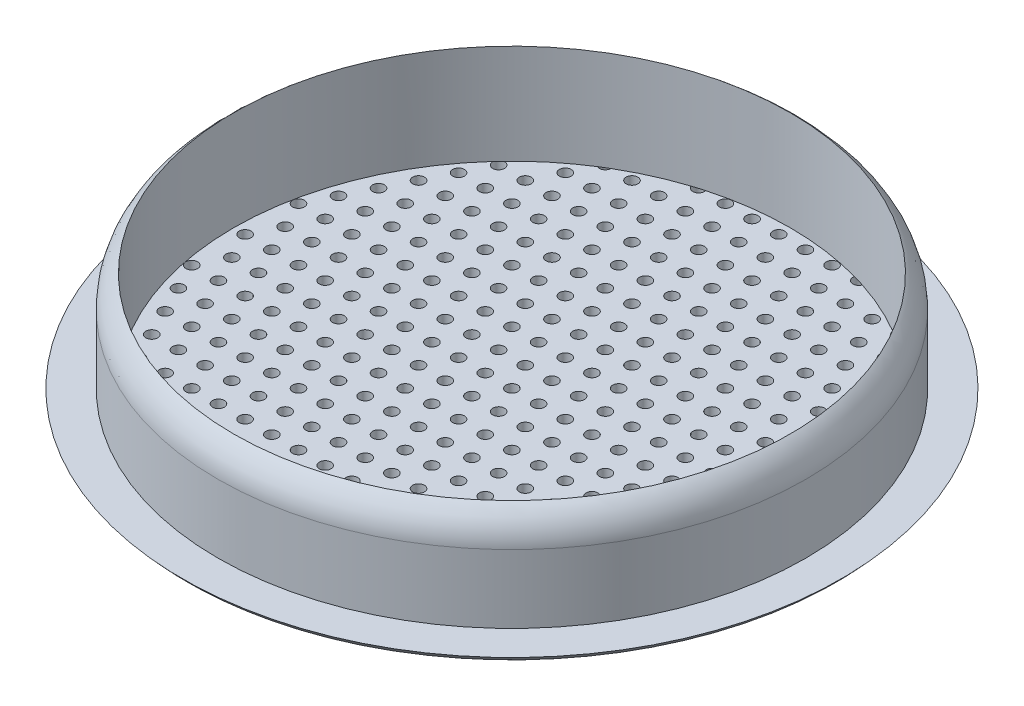
from build123d import *

# Parameters (mm, degrees)
SKETCH3_R          = 0.75
CUT_EXTRUDE1_DEPTH = 2
FILLET1_R          = 5


with BuildPart() as part:
    # Sketch2 → Revolve1 (revolve)
    with BuildSketch(Plane.XY, mode=Mode.PRIVATE) as revolve1_sk:
        Polygon((-35.465, 0), (-35.465, 12.7), (-37.465, 12.7), (-37.465, 0), (-42, 0), (-42, -2), (0, -2), (0, 0), align=None)
    revolve(revolve1_sk.sketch.rotate(Axis((0, 0, 0), (0, 1, 0)), 270), axis=Axis((0, 0, 0), (0, 1, 0)))

    # Sketch3 → Cut-Extrude1 (cut)
    with BuildSketch(Plane(origin=(0, 0, 0), x_dir=(1, 0, 0), z_dir=(0, 1, 0))):
        with Locations(Location((0, 0, 0), (0, 0, 270))):
            Circle(SKETCH3_R)
        with Locations(Location((3.4, 0, 0), (0, 0, 270))):
            Circle(SKETCH3_R)
        with Locations(Location((6.8, 0, 0), (0, 0, 270))):
            Circle(SKETCH3_R)
        with Locations(Location((10.2, 0, 0), (0, 0, 270))):
            Circle(SKETCH3_R)
        with Locations(Location((13.6, 0, 0), (0, 0, 270))):
            Circle(SKETCH3_R)
        with Locations(Location((17, 0, 0), (0, 0, 270))):
            Circle(SKETCH3_R)
        with Locations(Location((20.4, 0, 0), (0, 0, 270))):
            Circle(SKETCH3_R)
        with Locations(Location((23.8, 0, 0), (0, 0, 270))):
            Circle(SKETCH3_R)
        with Locations(Location((27.2, 0, 0), (0, 0, 270))):
            Circle(SKETCH3_R)
        with Locations(Location((30.6, 0, 0), (0, 0, 270))):
            Circle(SKETCH3_R)
        with Locations(Location((34, 0, 0), (0, 0, 270))):
            Circle(SKETCH3_R)
        with Locations(Location((3.4, 6.8, 0), (0, 0, 270))):
            Circle(SKETCH3_R)
        with Locations(Location((6.8, 6.8, 0), (0, 0, 270))):
            Circle(SKETCH3_R)
        with Locations(Location((10.2, 6.8, 0), (0, 0, 270))):
            Circle(SKETCH3_R)
        with Locations(Location((13.6, 6.8, 0), (0, 0, 270))):
            Circle(SKETCH3_R)
        with Locations(Location((17, 6.8, 0), (0, 0, 270))):
            Circle(SKETCH3_R)
        with Locations(Location((20.4, 6.8, 0), (0, 0, 270))):
            Circle(SKETCH3_R)
        with Locations(Location((23.8, 6.8, 0), (0, 0, 270))):
            Circle(SKETCH3_R)
        with Locations(Location((27.2, 6.8, 0), (0, 0, 270))):
            Circle(SKETCH3_R)
        with Locations(Location((30.6, 6.8, 0), (0, 0, 270))):
            Circle(SKETCH3_R)
        with Locations(Location((34, 6.8, 0), (0, 0, 270))):
            Circle(SKETCH3_R)
        with Locations(Location((3.4, 13.6, 0), (0, 0, 270))):
            Circle(SKETCH3_R)
        with Locations(Location((6.8, 13.6, 0), (0, 0, 270))):
            Circle(SKETCH3_R)
        with Locations(Location((10.2, 13.6, 0), (0, 0, 270))):
            Circle(SKETCH3_R)
        with Locations(Location((13.6, 13.6, 0), (0, 0, 270))):
            Circle(SKETCH3_R)
        with Locations(Location((17, 13.6, 0), (0, 0, 270))):
            Circle(SKETCH3_R)
        with Locations(Location((20.4, 13.6, 0), (0, 0, 270))):
            Circle(SKETCH3_R)
        with Locations(Location((23.8, 13.6, 0), (0, 0, 270))):
            Circle(SKETCH3_R)
        with Locations(Location((27.2, 13.6, 0), (0, 0, 270))):
            Circle(SKETCH3_R)
        with Locations(Location((30.6, 13.6, 0), (0, 0, 270))):
            Circle(SKETCH3_R)
        with Locations(Location((3.4, 20.4, 0), (0, 0, 270))):
            Circle(SKETCH3_R)
        with Locations(Location((6.8, 20.4, 0), (0, 0, 270))):
            Circle(SKETCH3_R)
        with Locations(Location((10.2, 20.4, 0), (0, 0, 270))):
            Circle(SKETCH3_R)
        with Locations(Location((13.6, 20.4, 0), (0, 0, 270))):
            Circle(SKETCH3_R)
        with Locations(Location((17, 20.4, 0), (0, 0, 270))):
            Circle(SKETCH3_R)
        with Locations(Location((20.4, 20.4, 0), (0, 0, 270))):
            Circle(SKETCH3_R)
        with Locations(Location((23.8, 20.4, 0), (0, 0, 270))):
            Circle(SKETCH3_R)
        with Locations(Location((27.2, 20.4, 0), (0, 0, 270))):
            Circle(SKETCH3_R)
        with Locations(Location((3.4, 27.2, 0), (0, 0, 270))):
            Circle(SKETCH3_R)
        with Locations(Location((6.8, 27.2, 0), (0, 0, 270))):
            Circle(SKETCH3_R)
        with Locations(Location((10.2, 27.2, 0), (0, 0, 270))):
            Circle(SKETCH3_R)
        with Locations(Location((13.6, 27.2, 0), (0, 0, 270))):
            Circle(SKETCH3_R)
        with Locations(Location((17, 27.2, 0), (0, 0, 270))):
            Circle(SKETCH3_R)
        with Locations(Location((20.4, 27.2, 0), (0, 0, 270))):
            Circle(SKETCH3_R)
        with Locations(Location((3.4, 34, 0), (0, 0, 270))):
            Circle(SKETCH3_R)
        with Locations(Location((6.8, 34, 0), (0, 0, 270))):
            Circle(SKETCH3_R)
        with Locations(Location((10.2, 34, 0), (0, 0, 270))):
            Circle(SKETCH3_R)
        with Locations(Location((13.6, 34, 0), (0, 0, 270))):
            Circle(SKETCH3_R)
        with Locations(Location((0, 6.8, 0), (0, 0, 270))):
            Circle(SKETCH3_R)
        with Locations(Location((0, 13.6, 0), (0, 0, 270))):
            Circle(SKETCH3_R)
        with Locations(Location((0, 20.4, 0), (0, 0, 270))):
            Circle(SKETCH3_R)
        with Locations(Location((0, 27.2, 0), (0, 0, 270))):
            Circle(SKETCH3_R)
        with Locations(Location((0, 34, 0), (0, 0, 270))):
            Circle(SKETCH3_R)
        with Locations(Location((1.7, 3.4, 0), (0, 0, 270))):
            Circle(SKETCH3_R)
        with Locations(Location((5.1, 3.4, 0), (0, 0, 270))):
            Circle(SKETCH3_R)
        with Locations(Location((8.5, 3.4, 0), (0, 0, 270))):
            Circle(SKETCH3_R)
        with Locations(Location((11.9, 3.4, 0), (0, 0, 270))):
            Circle(SKETCH3_R)
        with Locations(Location((15.3, 3.4, 0), (0, 0, 270))):
            Circle(SKETCH3_R)
        with Locations(Location((18.7, 3.4, 0), (0, 0, 270))):
            Circle(SKETCH3_R)
        with Locations(Location((22.1, 3.4, 0), (0, 0, 270))):
            Circle(SKETCH3_R)
        with Locations(Location((25.5, 3.4, 0), (0, 0, 270))):
            Circle(SKETCH3_R)
        with Locations(Location((28.9, 3.4, 0), (0, 0, 270))):
            Circle(SKETCH3_R)
        with Locations(Location((32.3, 3.4, 0), (0, 0, 270))):
            Circle(SKETCH3_R)
        with Locations(Location((5.1, 10.2, 0), (0, 0, 270))):
            Circle(SKETCH3_R)
        with Locations(Location((8.5, 10.2, 0), (0, 0, 270))):
            Circle(SKETCH3_R)
        with Locations(Location((11.9, 10.2, 0), (0, 0, 270))):
            Circle(SKETCH3_R)
        with Locations(Location((15.3, 10.2, 0), (0, 0, 270))):
            Circle(SKETCH3_R)
        with Locations(Location((18.7, 10.2, 0), (0, 0, 270))):
            Circle(SKETCH3_R)
        with Locations(Location((22.1, 10.2, 0), (0, 0, 270))):
            Circle(SKETCH3_R)
        with Locations(Location((25.5, 10.2, 0), (0, 0, 270))):
            Circle(SKETCH3_R)
        with Locations(Location((28.9, 10.2, 0), (0, 0, 270))):
            Circle(SKETCH3_R)
        with Locations(Location((32.3, 10.2, 0), (0, 0, 270))):
            Circle(SKETCH3_R)
        with Locations(Location((5.1, 17, 0), (0, 0, 270))):
            Circle(SKETCH3_R)
        with Locations(Location((8.5, 17, 0), (0, 0, 270))):
            Circle(SKETCH3_R)
        with Locations(Location((11.9, 17, 0), (0, 0, 270))):
            Circle(SKETCH3_R)
        with Locations(Location((15.3, 17, 0), (0, 0, 270))):
            Circle(SKETCH3_R)
        with Locations(Location((18.7, 17, 0), (0, 0, 270))):
            Circle(SKETCH3_R)
        with Locations(Location((22.1, 17, 0), (0, 0, 270))):
            Circle(SKETCH3_R)
        with Locations(Location((25.5, 17, 0), (0, 0, 270))):
            Circle(SKETCH3_R)
        with Locations(Location((28.9, 17, 0), (0, 0, 270))):
            Circle(SKETCH3_R)
        with Locations(Location((5.1, 23.8, 0), (0, 0, 270))):
            Circle(SKETCH3_R)
        with Locations(Location((8.5, 23.8, 0), (0, 0, 270))):
            Circle(SKETCH3_R)
        with Locations(Location((11.9, 23.8, 0), (0, 0, 270))):
            Circle(SKETCH3_R)
        with Locations(Location((15.3, 23.8, 0), (0, 0, 270))):
            Circle(SKETCH3_R)
        with Locations(Location((18.7, 23.8, 0), (0, 0, 270))):
            Circle(SKETCH3_R)
        with Locations(Location((22.1, 23.8, 0), (0, 0, 270))):
            Circle(SKETCH3_R)
        with Locations(Location((25.5, 23.8, 0), (0, 0, 270))):
            Circle(SKETCH3_R)
        with Locations(Location((5.1, 30.6, 0), (0, 0, 270))):
            Circle(SKETCH3_R)
        with Locations(Location((8.5, 30.6, 0), (0, 0, 270))):
            Circle(SKETCH3_R)
        with Locations(Location((11.9, 30.6, 0), (0, 0, 270))):
            Circle(SKETCH3_R)
        with Locations(Location((15.3, 30.6, 0), (0, 0, 270))):
            Circle(SKETCH3_R)
        with Locations(Location((18.7, 30.6, 0), (0, 0, 270))):
            Circle(SKETCH3_R)
        with Locations(Location((1.7, 10.2, 0), (0, 0, 270))):
            Circle(SKETCH3_R)
        with Locations(Location((1.7, 17, 0), (0, 0, 270))):
            Circle(SKETCH3_R)
        with Locations(Location((1.7, 23.8, 0), (0, 0, 270))):
            Circle(SKETCH3_R)
        with Locations(Location((1.7, 30.6, 0), (0, 0, 270))):
            Circle(SKETCH3_R)
        with Locations(Location((-1.7, 30.6, 0), (0, 0, 270))):
            Circle(SKETCH3_R)
        with Locations(Location((-1.7, 23.8, 0), (0, 0, 270))):
            Circle(SKETCH3_R)
        with Locations(Location((-1.7, 17, 0), (0, 0, 270))):
            Circle(SKETCH3_R)
        with Locations(Location((-1.7, 10.2, 0), (0, 0, 270))):
            Circle(SKETCH3_R)
        with Locations(Location((-18.7, 30.6, 0), (0, 0, 270))):
            Circle(SKETCH3_R)
        with Locations(Location((-15.3, 30.6, 0), (0, 0, 270))):
            Circle(SKETCH3_R)
        with Locations(Location((-11.9, 30.6, 0), (0, 0, 270))):
            Circle(SKETCH3_R)
        with Locations(Location((-8.5, 30.6, 0), (0, 0, 270))):
            Circle(SKETCH3_R)
        with Locations(Location((-5.1, 30.6, 0), (0, 0, 270))):
            Circle(SKETCH3_R)
        with Locations(Location((-25.5, 23.8, 0), (0, 0, 270))):
            Circle(SKETCH3_R)
        with Locations(Location((-22.1, 23.8, 0), (0, 0, 270))):
            Circle(SKETCH3_R)
        with Locations(Location((-18.7, 23.8, 0), (0, 0, 270))):
            Circle(SKETCH3_R)
        with Locations(Location((-15.3, 23.8, 0), (0, 0, 270))):
            Circle(SKETCH3_R)
        with Locations(Location((-11.9, 23.8, 0), (0, 0, 270))):
            Circle(SKETCH3_R)
        with Locations(Location((-8.5, 23.8, 0), (0, 0, 270))):
            Circle(SKETCH3_R)
        with Locations(Location((-5.1, 23.8, 0), (0, 0, 270))):
            Circle(SKETCH3_R)
        with Locations(Location((-28.9, 17, 0), (0, 0, 270))):
            Circle(SKETCH3_R)
        with Locations(Location((-25.5, 17, 0), (0, 0, 270))):
            Circle(SKETCH3_R)
        with Locations(Location((-22.1, 17, 0), (0, 0, 270))):
            Circle(SKETCH3_R)
        with Locations(Location((-18.7, 17, 0), (0, 0, 270))):
            Circle(SKETCH3_R)
        with Locations(Location((-15.3, 17, 0), (0, 0, 270))):
            Circle(SKETCH3_R)
        with Locations(Location((-11.9, 17, 0), (0, 0, 270))):
            Circle(SKETCH3_R)
        with Locations(Location((-8.5, 17, 0), (0, 0, 270))):
            Circle(SKETCH3_R)
        with Locations(Location((-5.1, 17, 0), (0, 0, 270))):
            Circle(SKETCH3_R)
        with Locations(Location((-32.3, 10.2, 0), (0, 0, 270))):
            Circle(SKETCH3_R)
        with Locations(Location((-28.9, 10.2, 0), (0, 0, 270))):
            Circle(SKETCH3_R)
        with Locations(Location((-25.5, 10.2, 0), (0, 0, 270))):
            Circle(SKETCH3_R)
        with Locations(Location((-22.1, 10.2, 0), (0, 0, 270))):
            Circle(SKETCH3_R)
        with Locations(Location((-18.7, 10.2, 0), (0, 0, 270))):
            Circle(SKETCH3_R)
        with Locations(Location((-15.3, 10.2, 0), (0, 0, 270))):
            Circle(SKETCH3_R)
        with Locations(Location((-11.9, 10.2, 0), (0, 0, 270))):
            Circle(SKETCH3_R)
        with Locations(Location((-8.5, 10.2, 0), (0, 0, 270))):
            Circle(SKETCH3_R)
        with Locations(Location((-5.1, 10.2, 0), (0, 0, 270))):
            Circle(SKETCH3_R)
        with Locations(Location((-32.3, 3.4, 0), (0, 0, 270))):
            Circle(SKETCH3_R)
        with Locations(Location((-28.9, 3.4, 0), (0, 0, 270))):
            Circle(SKETCH3_R)
        with Locations(Location((-25.5, 3.4, 0), (0, 0, 270))):
            Circle(SKETCH3_R)
        with Locations(Location((-22.1, 3.4, 0), (0, 0, 270))):
            Circle(SKETCH3_R)
        with Locations(Location((-18.7, 3.4, 0), (0, 0, 270))):
            Circle(SKETCH3_R)
        with Locations(Location((-15.3, 3.4, 0), (0, 0, 270))):
            Circle(SKETCH3_R)
        with Locations(Location((-11.9, 3.4, 0), (0, 0, 270))):
            Circle(SKETCH3_R)
        with Locations(Location((-8.5, 3.4, 0), (0, 0, 270))):
            Circle(SKETCH3_R)
        with Locations(Location((-5.1, 3.4, 0), (0, 0, 270))):
            Circle(SKETCH3_R)
        with Locations(Location((-1.7, 3.4, 0), (0, 0, 270))):
            Circle(SKETCH3_R)
        with Locations(Location((-13.6, 34, 0), (0, 0, 270))):
            Circle(SKETCH3_R)
        with Locations(Location((-10.2, 34, 0), (0, 0, 270))):
            Circle(SKETCH3_R)
        with Locations(Location((-6.8, 34, 0), (0, 0, 270))):
            Circle(SKETCH3_R)
        with Locations(Location((-3.4, 34, 0), (0, 0, 270))):
            Circle(SKETCH3_R)
        with Locations(Location((-20.4, 27.2, 0), (0, 0, 270))):
            Circle(SKETCH3_R)
        with Locations(Location((-17, 27.2, 0), (0, 0, 270))):
            Circle(SKETCH3_R)
        with Locations(Location((-13.6, 27.2, 0), (0, 0, 270))):
            Circle(SKETCH3_R)
        with Locations(Location((-10.2, 27.2, 0), (0, 0, 270))):
            Circle(SKETCH3_R)
        with Locations(Location((-6.8, 27.2, 0), (0, 0, 270))):
            Circle(SKETCH3_R)
        with Locations(Location((-3.4, 27.2, 0), (0, 0, 270))):
            Circle(SKETCH3_R)
        with Locations(Location((-27.2, 20.4, 0), (0, 0, 270))):
            Circle(SKETCH3_R)
        with Locations(Location((-23.8, 20.4, 0), (0, 0, 270))):
            Circle(SKETCH3_R)
        with Locations(Location((-20.4, 20.4, 0), (0, 0, 270))):
            Circle(SKETCH3_R)
        with Locations(Location((-17, 20.4, 0), (0, 0, 270))):
            Circle(SKETCH3_R)
        with Locations(Location((-13.6, 20.4, 0), (0, 0, 270))):
            Circle(SKETCH3_R)
        with Locations(Location((-10.2, 20.4, 0), (0, 0, 270))):
            Circle(SKETCH3_R)
        with Locations(Location((-6.8, 20.4, 0), (0, 0, 270))):
            Circle(SKETCH3_R)
        with Locations(Location((-3.4, 20.4, 0), (0, 0, 270))):
            Circle(SKETCH3_R)
        with Locations(Location((-30.6, 13.6, 0), (0, 0, 270))):
            Circle(SKETCH3_R)
        with Locations(Location((-27.2, 13.6, 0), (0, 0, 270))):
            Circle(SKETCH3_R)
        with Locations(Location((-23.8, 13.6, 0), (0, 0, 270))):
            Circle(SKETCH3_R)
        with Locations(Location((-20.4, 13.6, 0), (0, 0, 270))):
            Circle(SKETCH3_R)
        with Locations(Location((-17, 13.6, 0), (0, 0, 270))):
            Circle(SKETCH3_R)
        with Locations(Location((-13.6, 13.6, 0), (0, 0, 270))):
            Circle(SKETCH3_R)
        with Locations(Location((-10.2, 13.6, 0), (0, 0, 270))):
            Circle(SKETCH3_R)
        with Locations(Location((-6.8, 13.6, 0), (0, 0, 270))):
            Circle(SKETCH3_R)
        with Locations(Location((-3.4, 13.6, 0), (0, 0, 270))):
            Circle(SKETCH3_R)
        with Locations(Location((-34, 6.8, 0), (0, 0, 270))):
            Circle(SKETCH3_R)
        with Locations(Location((-30.6, 6.8, 0), (0, 0, 270))):
            Circle(SKETCH3_R)
        with Locations(Location((-27.2, 6.8, 0), (0, 0, 270))):
            Circle(SKETCH3_R)
        with Locations(Location((-23.8, 6.8, 0), (0, 0, 270))):
            Circle(SKETCH3_R)
        with Locations(Location((-20.4, 6.8, 0), (0, 0, 270))):
            Circle(SKETCH3_R)
        with Locations(Location((-17, 6.8, 0), (0, 0, 270))):
            Circle(SKETCH3_R)
        with Locations(Location((-13.6, 6.8, 0), (0, 0, 270))):
            Circle(SKETCH3_R)
        with Locations(Location((-10.2, 6.8, 0), (0, 0, 270))):
            Circle(SKETCH3_R)
        with Locations(Location((-6.8, 6.8, 0), (0, 0, 270))):
            Circle(SKETCH3_R)
        with Locations(Location((-3.4, 6.8, 0), (0, 0, 270))):
            Circle(SKETCH3_R)
        with Locations(Location((-34, 0, 0), (0, 0, 270))):
            Circle(SKETCH3_R)
        with Locations(Location((-30.6, 0, 0), (0, 0, 270))):
            Circle(SKETCH3_R)
        with Locations(Location((-27.2, 0, 0), (0, 0, 270))):
            Circle(SKETCH3_R)
        with Locations(Location((-23.8, 0, 0), (0, 0, 270))):
            Circle(SKETCH3_R)
        with Locations(Location((-20.4, 0, 0), (0, 0, 270))):
            Circle(SKETCH3_R)
        with Locations(Location((-17, 0, 0), (0, 0, 270))):
            Circle(SKETCH3_R)
        with Locations(Location((-13.6, 0, 0), (0, 0, 270))):
            Circle(SKETCH3_R)
        with Locations(Location((-10.2, 0, 0), (0, 0, 270))):
            Circle(SKETCH3_R)
        with Locations(Location((-6.8, 0, 0), (0, 0, 270))):
            Circle(SKETCH3_R)
        with Locations(Location((-3.4, 0, 0), (0, 0, 270))):
            Circle(SKETCH3_R)
        with Locations(Location((-3.4, -6.8, 0), (0, 0, 270))):
            Circle(SKETCH3_R)
        with Locations(Location((-6.8, -6.8, 0), (0, 0, 270))):
            Circle(SKETCH3_R)
        with Locations(Location((-10.2, -6.8, 0), (0, 0, 270))):
            Circle(SKETCH3_R)
        with Locations(Location((-13.6, -6.8, 0), (0, 0, 270))):
            Circle(SKETCH3_R)
        with Locations(Location((-17, -6.8, 0), (0, 0, 270))):
            Circle(SKETCH3_R)
        with Locations(Location((-20.4, -6.8, 0), (0, 0, 270))):
            Circle(SKETCH3_R)
        with Locations(Location((-23.8, -6.8, 0), (0, 0, 270))):
            Circle(SKETCH3_R)
        with Locations(Location((-27.2, -6.8, 0), (0, 0, 270))):
            Circle(SKETCH3_R)
        with Locations(Location((-30.6, -6.8, 0), (0, 0, 270))):
            Circle(SKETCH3_R)
        with Locations(Location((-34, -6.8, 0), (0, 0, 270))):
            Circle(SKETCH3_R)
        with Locations(Location((-3.4, -13.6, 0), (0, 0, 270))):
            Circle(SKETCH3_R)
        with Locations(Location((-6.8, -13.6, 0), (0, 0, 270))):
            Circle(SKETCH3_R)
        with Locations(Location((-10.2, -13.6, 0), (0, 0, 270))):
            Circle(SKETCH3_R)
        with Locations(Location((-13.6, -13.6, 0), (0, 0, 270))):
            Circle(SKETCH3_R)
        with Locations(Location((-17, -13.6, 0), (0, 0, 270))):
            Circle(SKETCH3_R)
        with Locations(Location((-20.4, -13.6, 0), (0, 0, 270))):
            Circle(SKETCH3_R)
        with Locations(Location((-23.8, -13.6, 0), (0, 0, 270))):
            Circle(SKETCH3_R)
        with Locations(Location((-27.2, -13.6, 0), (0, 0, 270))):
            Circle(SKETCH3_R)
        with Locations(Location((-30.6, -13.6, 0), (0, 0, 270))):
            Circle(SKETCH3_R)
        with Locations(Location((-3.4, -20.4, 0), (0, 0, 270))):
            Circle(SKETCH3_R)
        with Locations(Location((-6.8, -20.4, 0), (0, 0, 270))):
            Circle(SKETCH3_R)
        with Locations(Location((-10.2, -20.4, 0), (0, 0, 270))):
            Circle(SKETCH3_R)
        with Locations(Location((-13.6, -20.4, 0), (0, 0, 270))):
            Circle(SKETCH3_R)
        with Locations(Location((-17, -20.4, 0), (0, 0, 270))):
            Circle(SKETCH3_R)
        with Locations(Location((-20.4, -20.4, 0), (0, 0, 270))):
            Circle(SKETCH3_R)
        with Locations(Location((-23.8, -20.4, 0), (0, 0, 270))):
            Circle(SKETCH3_R)
        with Locations(Location((-27.2, -20.4, 0), (0, 0, 270))):
            Circle(SKETCH3_R)
        with Locations(Location((-3.4, -27.2, 0), (0, 0, 270))):
            Circle(SKETCH3_R)
        with Locations(Location((-6.8, -27.2, 0), (0, 0, 270))):
            Circle(SKETCH3_R)
        with Locations(Location((-10.2, -27.2, 0), (0, 0, 270))):
            Circle(SKETCH3_R)
        with Locations(Location((-13.6, -27.2, 0), (0, 0, 270))):
            Circle(SKETCH3_R)
        with Locations(Location((-17, -27.2, 0), (0, 0, 270))):
            Circle(SKETCH3_R)
        with Locations(Location((-20.4, -27.2, 0), (0, 0, 270))):
            Circle(SKETCH3_R)
        with Locations(Location((-3.4, -34, 0), (0, 0, 270))):
            Circle(SKETCH3_R)
        with Locations(Location((-6.8, -34, 0), (0, 0, 270))):
            Circle(SKETCH3_R)
        with Locations(Location((-10.2, -34, 0), (0, 0, 270))):
            Circle(SKETCH3_R)
        with Locations(Location((-13.6, -34, 0), (0, 0, 270))):
            Circle(SKETCH3_R)
        with Locations(Location((-1.7, -3.4, 0), (0, 0, 270))):
            Circle(SKETCH3_R)
        with Locations(Location((-5.1, -3.4, 0), (0, 0, 270))):
            Circle(SKETCH3_R)
        with Locations(Location((-8.5, -3.4, 0), (0, 0, 270))):
            Circle(SKETCH3_R)
        with Locations(Location((-11.9, -3.4, 0), (0, 0, 270))):
            Circle(SKETCH3_R)
        with Locations(Location((-15.3, -3.4, 0), (0, 0, 270))):
            Circle(SKETCH3_R)
        with Locations(Location((-18.7, -3.4, 0), (0, 0, 270))):
            Circle(SKETCH3_R)
        with Locations(Location((-22.1, -3.4, 0), (0, 0, 270))):
            Circle(SKETCH3_R)
        with Locations(Location((-25.5, -3.4, 0), (0, 0, 270))):
            Circle(SKETCH3_R)
        with Locations(Location((-28.9, -3.4, 0), (0, 0, 270))):
            Circle(SKETCH3_R)
        with Locations(Location((-32.3, -3.4, 0), (0, 0, 270))):
            Circle(SKETCH3_R)
        with Locations(Location((-5.1, -10.2, 0), (0, 0, 270))):
            Circle(SKETCH3_R)
        with Locations(Location((-8.5, -10.2, 0), (0, 0, 270))):
            Circle(SKETCH3_R)
        with Locations(Location((-11.9, -10.2, 0), (0, 0, 270))):
            Circle(SKETCH3_R)
        with Locations(Location((-15.3, -10.2, 0), (0, 0, 270))):
            Circle(SKETCH3_R)
        with Locations(Location((-18.7, -10.2, 0), (0, 0, 270))):
            Circle(SKETCH3_R)
        with Locations(Location((-22.1, -10.2, 0), (0, 0, 270))):
            Circle(SKETCH3_R)
        with Locations(Location((-25.5, -10.2, 0), (0, 0, 270))):
            Circle(SKETCH3_R)
        with Locations(Location((-28.9, -10.2, 0), (0, 0, 270))):
            Circle(SKETCH3_R)
        with Locations(Location((-32.3, -10.2, 0), (0, 0, 270))):
            Circle(SKETCH3_R)
        with Locations(Location((-5.1, -17, 0), (0, 0, 270))):
            Circle(SKETCH3_R)
        with Locations(Location((-8.5, -17, 0), (0, 0, 270))):
            Circle(SKETCH3_R)
        with Locations(Location((-11.9, -17, 0), (0, 0, 270))):
            Circle(SKETCH3_R)
        with Locations(Location((-15.3, -17, 0), (0, 0, 270))):
            Circle(SKETCH3_R)
        with Locations(Location((-18.7, -17, 0), (0, 0, 270))):
            Circle(SKETCH3_R)
        with Locations(Location((-22.1, -17, 0), (0, 0, 270))):
            Circle(SKETCH3_R)
        with Locations(Location((-25.5, -17, 0), (0, 0, 270))):
            Circle(SKETCH3_R)
        with Locations(Location((-28.9, -17, 0), (0, 0, 270))):
            Circle(SKETCH3_R)
        with Locations(Location((-5.1, -23.8, 0), (0, 0, 270))):
            Circle(SKETCH3_R)
        with Locations(Location((-8.5, -23.8, 0), (0, 0, 270))):
            Circle(SKETCH3_R)
        with Locations(Location((-11.9, -23.8, 0), (0, 0, 270))):
            Circle(SKETCH3_R)
        with Locations(Location((-15.3, -23.8, 0), (0, 0, 270))):
            Circle(SKETCH3_R)
        with Locations(Location((-18.7, -23.8, 0), (0, 0, 270))):
            Circle(SKETCH3_R)
        with Locations(Location((-22.1, -23.8, 0), (0, 0, 270))):
            Circle(SKETCH3_R)
        with Locations(Location((-25.5, -23.8, 0), (0, 0, 270))):
            Circle(SKETCH3_R)
        with Locations(Location((-5.1, -30.6, 0), (0, 0, 270))):
            Circle(SKETCH3_R)
        with Locations(Location((-8.5, -30.6, 0), (0, 0, 270))):
            Circle(SKETCH3_R)
        with Locations(Location((-11.9, -30.6, 0), (0, 0, 270))):
            Circle(SKETCH3_R)
        with Locations(Location((-15.3, -30.6, 0), (0, 0, 270))):
            Circle(SKETCH3_R)
        with Locations(Location((-18.7, -30.6, 0), (0, 0, 270))):
            Circle(SKETCH3_R)
        with Locations(Location((-1.7, -10.2, 0), (0, 0, 270))):
            Circle(SKETCH3_R)
        with Locations(Location((-1.7, -17, 0), (0, 0, 270))):
            Circle(SKETCH3_R)
        with Locations(Location((-1.7, -23.8, 0), (0, 0, 270))):
            Circle(SKETCH3_R)
        with Locations(Location((-1.7, -30.6, 0), (0, 0, 270))):
            Circle(SKETCH3_R)
        with Locations(Location((1.7, -30.6, 0), (0, 0, 270))):
            Circle(SKETCH3_R)
        with Locations(Location((1.7, -23.8, 0), (0, 0, 270))):
            Circle(SKETCH3_R)
        with Locations(Location((1.7, -17, 0), (0, 0, 270))):
            Circle(SKETCH3_R)
        with Locations(Location((1.7, -10.2, 0), (0, 0, 270))):
            Circle(SKETCH3_R)
        with Locations(Location((18.7, -30.6, 0), (0, 0, 270))):
            Circle(SKETCH3_R)
        with Locations(Location((15.3, -30.6, 0), (0, 0, 270))):
            Circle(SKETCH3_R)
        with Locations(Location((11.9, -30.6, 0), (0, 0, 270))):
            Circle(SKETCH3_R)
        with Locations(Location((8.5, -30.6, 0), (0, 0, 270))):
            Circle(SKETCH3_R)
        with Locations(Location((5.1, -30.6, 0), (0, 0, 270))):
            Circle(SKETCH3_R)
        with Locations(Location((25.5, -23.8, 0), (0, 0, 270))):
            Circle(SKETCH3_R)
        with Locations(Location((22.1, -23.8, 0), (0, 0, 270))):
            Circle(SKETCH3_R)
        with Locations(Location((18.7, -23.8, 0), (0, 0, 270))):
            Circle(SKETCH3_R)
        with Locations(Location((15.3, -23.8, 0), (0, 0, 270))):
            Circle(SKETCH3_R)
        with Locations(Location((11.9, -23.8, 0), (0, 0, 270))):
            Circle(SKETCH3_R)
        with Locations(Location((8.5, -23.8, 0), (0, 0, 270))):
            Circle(SKETCH3_R)
        with Locations(Location((5.1, -23.8, 0), (0, 0, 270))):
            Circle(SKETCH3_R)
        with Locations(Location((28.9, -17, 0), (0, 0, 270))):
            Circle(SKETCH3_R)
        with Locations(Location((25.5, -17, 0), (0, 0, 270))):
            Circle(SKETCH3_R)
        with Locations(Location((22.1, -17, 0), (0, 0, 270))):
            Circle(SKETCH3_R)
        with Locations(Location((18.7, -17, 0), (0, 0, 270))):
            Circle(SKETCH3_R)
        with Locations(Location((15.3, -17, 0), (0, 0, 270))):
            Circle(SKETCH3_R)
        with Locations(Location((11.9, -17, 0), (0, 0, 270))):
            Circle(SKETCH3_R)
        with Locations(Location((8.5, -17, 0), (0, 0, 270))):
            Circle(SKETCH3_R)
        with Locations(Location((5.1, -17, 0), (0, 0, 270))):
            Circle(SKETCH3_R)
        with Locations(Location((32.3, -10.2, 0), (0, 0, 270))):
            Circle(SKETCH3_R)
        with Locations(Location((28.9, -10.2, 0), (0, 0, 270))):
            Circle(SKETCH3_R)
        with Locations(Location((25.5, -10.2, 0), (0, 0, 270))):
            Circle(SKETCH3_R)
        with Locations(Location((22.1, -10.2, 0), (0, 0, 270))):
            Circle(SKETCH3_R)
        with Locations(Location((18.7, -10.2, 0), (0, 0, 270))):
            Circle(SKETCH3_R)
        with Locations(Location((15.3, -10.2, 0), (0, 0, 270))):
            Circle(SKETCH3_R)
        with Locations(Location((11.9, -10.2, 0), (0, 0, 270))):
            Circle(SKETCH3_R)
        with Locations(Location((8.5, -10.2, 0), (0, 0, 270))):
            Circle(SKETCH3_R)
        with Locations(Location((5.1, -10.2, 0), (0, 0, 270))):
            Circle(SKETCH3_R)
        with Locations(Location((32.3, -3.4, 0), (0, 0, 270))):
            Circle(SKETCH3_R)
        with Locations(Location((28.9, -3.4, 0), (0, 0, 270))):
            Circle(SKETCH3_R)
        with Locations(Location((25.5, -3.4, 0), (0, 0, 270))):
            Circle(SKETCH3_R)
        with Locations(Location((22.1, -3.4, 0), (0, 0, 270))):
            Circle(SKETCH3_R)
        with Locations(Location((18.7, -3.4, 0), (0, 0, 270))):
            Circle(SKETCH3_R)
        with Locations(Location((15.3, -3.4, 0), (0, 0, 270))):
            Circle(SKETCH3_R)
        with Locations(Location((11.9, -3.4, 0), (0, 0, 270))):
            Circle(SKETCH3_R)
        with Locations(Location((8.5, -3.4, 0), (0, 0, 270))):
            Circle(SKETCH3_R)
        with Locations(Location((5.1, -3.4, 0), (0, 0, 270))):
            Circle(SKETCH3_R)
        with Locations(Location((1.7, -3.4, 0), (0, 0, 270))):
            Circle(SKETCH3_R)
        with Locations(Location((0, -34, 0), (0, 0, 270))):
            Circle(SKETCH3_R)
        with Locations(Location((0, -27.2, 0), (0, 0, 270))):
            Circle(SKETCH3_R)
        with Locations(Location((0, -20.4, 0), (0, 0, 270))):
            Circle(SKETCH3_R)
        with Locations(Location((0, -13.6, 0), (0, 0, 270))):
            Circle(SKETCH3_R)
        with Locations(Location((0, -6.8, 0), (0, 0, 270))):
            Circle(SKETCH3_R)
        with Locations(Location((13.6, -34, 0), (0, 0, 270))):
            Circle(SKETCH3_R)
        with Locations(Location((10.2, -34, 0), (0, 0, 270))):
            Circle(SKETCH3_R)
        with Locations(Location((6.8, -34, 0), (0, 0, 270))):
            Circle(SKETCH3_R)
        with Locations(Location((3.4, -34, 0), (0, 0, 270))):
            Circle(SKETCH3_R)
        with Locations(Location((20.4, -27.2, 0), (0, 0, 270))):
            Circle(SKETCH3_R)
        with Locations(Location((17, -27.2, 0), (0, 0, 270))):
            Circle(SKETCH3_R)
        with Locations(Location((13.6, -27.2, 0), (0, 0, 270))):
            Circle(SKETCH3_R)
        with Locations(Location((10.2, -27.2, 0), (0, 0, 270))):
            Circle(SKETCH3_R)
        with Locations(Location((6.8, -27.2, 0), (0, 0, 270))):
            Circle(SKETCH3_R)
        with Locations(Location((3.4, -27.2, 0), (0, 0, 270))):
            Circle(SKETCH3_R)
        with Locations(Location((27.2, -20.4, 0), (0, 0, 270))):
            Circle(SKETCH3_R)
        with Locations(Location((23.8, -20.4, 0), (0, 0, 270))):
            Circle(SKETCH3_R)
        with Locations(Location((20.4, -20.4, 0), (0, 0, 270))):
            Circle(SKETCH3_R)
        with Locations(Location((17, -20.4, 0), (0, 0, 270))):
            Circle(SKETCH3_R)
        with Locations(Location((13.6, -20.4, 0), (0, 0, 270))):
            Circle(SKETCH3_R)
        with Locations(Location((10.2, -20.4, 0), (0, 0, 270))):
            Circle(SKETCH3_R)
        with Locations(Location((6.8, -20.4, 0), (0, 0, 270))):
            Circle(SKETCH3_R)
        with Locations(Location((3.4, -20.4, 0), (0, 0, 270))):
            Circle(SKETCH3_R)
        with Locations(Location((30.6, -13.6, 0), (0, 0, 270))):
            Circle(SKETCH3_R)
        with Locations(Location((27.2, -13.6, 0), (0, 0, 270))):
            Circle(SKETCH3_R)
        with Locations(Location((23.8, -13.6, 0), (0, 0, 270))):
            Circle(SKETCH3_R)
        with Locations(Location((20.4, -13.6, 0), (0, 0, 270))):
            Circle(SKETCH3_R)
        with Locations(Location((17, -13.6, 0), (0, 0, 270))):
            Circle(SKETCH3_R)
        with Locations(Location((13.6, -13.6, 0), (0, 0, 270))):
            Circle(SKETCH3_R)
        with Locations(Location((10.2, -13.6, 0), (0, 0, 270))):
            Circle(SKETCH3_R)
        with Locations(Location((6.8, -13.6, 0), (0, 0, 270))):
            Circle(SKETCH3_R)
        with Locations(Location((3.4, -13.6, 0), (0, 0, 270))):
            Circle(SKETCH3_R)
        with Locations(Location((34, -6.8, 0), (0, 0, 270))):
            Circle(SKETCH3_R)
        with Locations(Location((30.6, -6.8, 0), (0, 0, 270))):
            Circle(SKETCH3_R)
        with Locations(Location((27.2, -6.8, 0), (0, 0, 270))):
            Circle(SKETCH3_R)
        with Locations(Location((23.8, -6.8, 0), (0, 0, 270))):
            Circle(SKETCH3_R)
        with Locations(Location((20.4, -6.8, 0), (0, 0, 270))):
            Circle(SKETCH3_R)
        with Locations(Location((17, -6.8, 0), (0, 0, 270))):
            Circle(SKETCH3_R)
        with Locations(Location((13.6, -6.8, 0), (0, 0, 270))):
            Circle(SKETCH3_R)
        with Locations(Location((10.2, -6.8, 0), (0, 0, 270))):
            Circle(SKETCH3_R)
        with Locations(Location((6.8, -6.8, 0), (0, 0, 270))):
            Circle(SKETCH3_R)
        with Locations(Location((3.4, -6.8, 0), (0, 0, 270))):
            Circle(SKETCH3_R)
    extrude(amount=-CUT_EXTRUDE1_DEPTH, mode=Mode.SUBTRACT)

    # Fillet1
    # the kernel refuses this fillet: 5 mm, written as the material it takes off along each edge
    with BuildSketch(Plane(origin=(0, 12.7, 0), x_dir=(0, 0, -1), z_dir=(1, 0, 0))) as fillet1_piece_1:
        with BuildLine():
            CenterArc((32.465, -4), FILLET1_R, 0, 53.130102354)
            Line((37.465, -4), (37.565, -4))
            Line((37.565, -4), (37.565, 0))
            Line((37.565, 0), (37.465, 0.1))
            ThreePointArc((37.465, 0.1), (36.465, 0.1), (35.525, 0.08))
            Line((35.525, 0.08), (35.465, 0))
        make_face()
    revolve(axis=Axis((0, 12.7, 0), (0, 1, 0)), mode=Mode.SUBTRACT)
    with BuildSketch(Plane(origin=(0, -2, 0), x_dir=(0, 0, -1), z_dir=(1, 0, 0))) as fillet1_piece_2:
        with BuildLine():
            CenterArc((38, 5), FILLET1_R, 270, 53.130102354)
            Line((42, 2), (42.08, 1.94))
            ThreePointArc((42.08, 1.94), (42.1, 1), (42.1, 0))
            Line((42.1, 0), (42, -0.1))
            Line((42, -0.1), (38, -0.1))
            Line((38, -0.1), (38, 0))
        make_face()
    revolve(axis=Axis((0, -2, 0), (0, 1, 0)), mode=Mode.SUBTRACT)


solid = part.part
